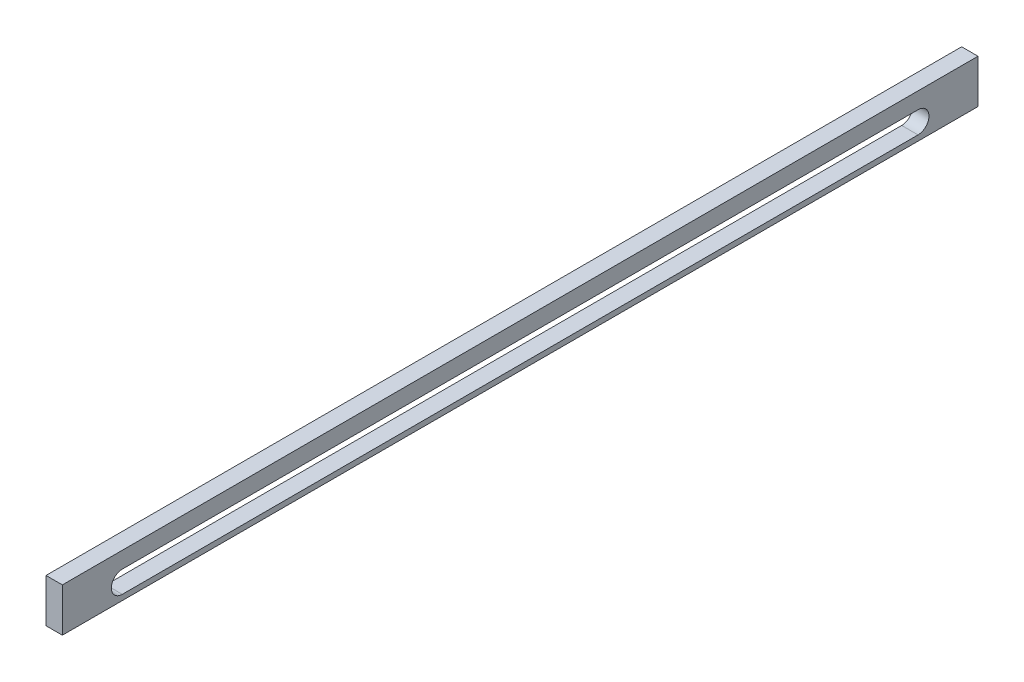
from build123d import *

# Parameters (mm, degrees)
BOSS_EXTRUDE1_DEPTH = 10
CUT_EXTRUDE1_DEPTH  = 10
SKETCH4_W           = 170
SKETCH4_H           = 2
CUT_EXTRUDE2_DEPTH  = 10
CUT_EXTRUDE4_START  = -10
CUT_EXTRUDE4_DEPTH  = 10
SKETCH9_W           = 4.225609452
SKETCH9_H           = 1
SKETCH9_W_2         = 4.088650431
CUT_EXTRUDE5_DEPTH  = 10


with BuildPart() as part:
    # Sketch1 → Boss-Extrude1 (new body)
    with BuildSketch(Plane(origin=(0, 0, 0), x_dir=(1, 0, 0), z_dir=(0, 1, 0))):
        with BuildLine():
            Line((11.152393634, 3.852474108), (11.152393634, 173.352474108))
            ThreePointArc((11.152393634, 173.352474108), (11.225616938, 173.529250803), (11.402393634, 173.602474108))
            Line((11.402393634, 173.602474108), (15.902393634, 173.602474108))
            ThreePointArc((15.902393634, 173.602474108), (16.079170329, 173.529250803), (16.152393634, 173.352474108))
            Line((16.152393634, 173.352474108), (16.152393634, 3.852474108))
            ThreePointArc((16.152393634, 3.852474108), (16.079170329, 3.675697413), (15.902393634, 3.602474108))
            Line((15.902393634, 3.602474108), (11.402393634, 3.602474108))
            ThreePointArc((11.402393634, 3.602474108), (11.225616938, 3.675697413), (11.152393634, 3.852474108))
        make_face()
    extrude(amount=BOSS_EXTRUDE1_DEPTH)

    # Sketch2 → Cut-Extrude1 (cut)
    with BuildSketch(Plane(origin=(16.152393634, 0, 0), x_dir=(0, 0, -1), z_dir=(1, 0, 0))):
        with BuildLine():
            Line((15.602474108, 7), (161.602474108, 7))
            ThreePointArc((161.602474108, 7), (163.602474108, 5), (161.602474108, 3))
            Line((161.602474108, 3), (15.602474108, 3))
            ThreePointArc((15.602474108, 3), (13.602474108, 5), (15.602474108, 7))
        make_face()
    extrude(amount=-CUT_EXTRUDE1_DEPTH, mode=Mode.SUBTRACT)

    # Sketch4 → Cut-Extrude2 (cut)
    with BuildSketch(Plane(origin=(16.152393634, 0, 0), x_dir=(0, 0, -1), z_dir=(1, 0, 0))):
        with Locations((88.602474108, 1)):
            Rectangle(SKETCH4_W, SKETCH4_H)
    extrude(amount=-CUT_EXTRUDE2_DEPTH, mode=Mode.SUBTRACT)

    # Sketch8 → Cut-Extrude4 (cut)
    with BuildSketch(Plane(origin=(0, 10, 0), x_dir=(1, 0, 0), z_dir=(0, 1, 0)).offset(CUT_EXTRUDE4_START)):
        with BuildLine():
            ThreePointArc((15.902393634, 3.602474108), (16.079170329, 3.675697413), (16.152393634, 3.852474108))
            Line((16.152393634, 3.852474108), (16.152393634, 173.352474108))
            ThreePointArc((16.152393634, 173.352474108), (16.079170329, 173.529250803), (15.902393634, 173.602474108))
            Line((15.902393634, 173.602474108), (15.152393634, 173.602474108))
            Line((15.152393634, 173.602474108), (15.152393634, 3.602474108))
            Line((15.152393634, 3.602474108), (15.902393634, 3.602474108))
        make_face()
        with BuildLine():
            Line((11.402393634, 3.602474108), (12.152393634, 3.602474108))
            Line((12.152393634, 3.602474108), (12.152393634, 173.602474108))
            Line((12.152393634, 173.602474108), (11.402393634, 173.602474108))
            ThreePointArc((11.402393634, 173.602474108), (11.225616938, 173.529250803), (11.152393634, 173.352474108))
            Line((11.152393634, 173.352474108), (11.152393634, 3.852474108))
            ThreePointArc((11.152393634, 3.852474108), (11.225616938, 3.675697413), (11.402393634, 3.602474108))
        make_face()
    extrude(amount=CUT_EXTRUDE4_DEPTH, mode=Mode.SUBTRACT)

    # Sketch9 → Cut-Extrude5 (cut)
    with BuildSketch(Plane(origin=(0, 10, 0), x_dir=(1, 0, 0), z_dir=(0, 1, 0))):
        with Locations((13.763215324, 173.102474108)):
            Rectangle(SKETCH9_W, SKETCH9_H)
        with Locations((13.694735813, 4.102474108)):
            Rectangle(SKETCH9_W_2, SKETCH9_H)
    extrude(amount=-CUT_EXTRUDE5_DEPTH, mode=Mode.SUBTRACT)


solid = part.part
